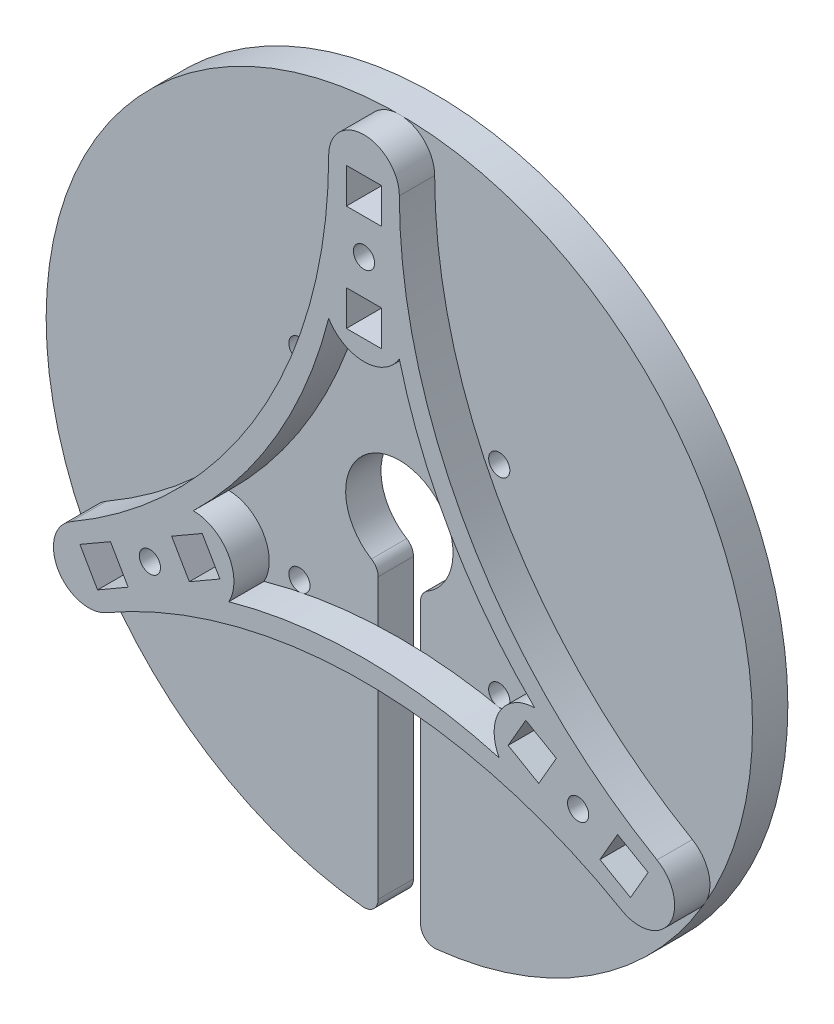
from build123d import *

# Parameters (mm, degrees)
BODY_MOVE_COPY2_START     = 18.4153099
BODY_MOVE_COPY2_OUTLINE_R = 1.5
BODY_MOVE_COPY2_OUTLINE_W = 5
BODY_MOVE_COPY2_OUTLINE_H = 5
BODY_MOVE_COPY2_DEPTH     = 5
SKETCH2_R                 = 1.5
SKETCH2_W                 = 5
SKETCH2_H                 = 5
BOSS_EXTRUDE1_DEPTH       = 5


# Read off the part's stored shape, not the designer's step: Body-Move/Copy2
with BuildPart() as part:
    # Body-Move/Copy2 outline → Body-Move/Copy2 (new body)
    with BuildSketch(Plane.XY.offset(BODY_MOVE_COPY2_START)):
        with BuildLine():
            ThreePointArc((-29.993059319, -14.335142591), (-30.249021858, -13.35619758), (-30.951392653, -12.62782582))
            ThreePointArc((-30.951392653, -12.62782582), (-26.993059319, 1.459977909), (-23.034725986, -12.62782582))
            ThreePointArc((-23.034725986, -12.62782582), (-23.737096781, -13.35619758), (-23.993059319, -14.335142591))
            Line((-23.993059319, -14.335142591), (-23.993059319, -53.87889514))
            ThreePointArc((-23.993059319, -53.87889514), (-23.331590853, -55.364941349), (-21.784725986, -55.868014851))
            ThreePointArc((-21.784725986, -55.868014851), (-26.993059319, 43.859977909), (-32.201392653, -55.868014851))
            ThreePointArc((-32.201392653, -55.868014851), (-30.654527786, -55.364941349), (-29.993059319, -53.87889514))
            Line((-29.993059319, -53.87889514), (-29.993059319, -14.335142591))
        make_face()
        Polygon((-67.21420249, -26.474958582), (-62.884075471, -23.974958582), (-60.384075471, -28.305085601), (-64.71420249, -30.805085601), align=None, mode=Mode.SUBTRACT)
        with Locations((-57.303948452, -23.640022091)):
            Circle(BODY_MOVE_COPY2_OUTLINE_R, mode=Mode.SUBTRACT)
        Polygon((-47.393694414, -20.805085601), (-51.723821433, -23.305085601), (-54.223821433, -18.974958582), (-49.893694414, -16.474958582), align=None, mode=Mode.SUBTRACT)
        with Locations((-41.135194943, -20.282157715)):
            Circle(BODY_MOVE_COPY2_OUTLINE_R, mode=Mode.SUBTRACT)
        with Locations((-12.850923696, -20.282157715)):
            Circle(BODY_MOVE_COPY2_OUTLINE_R, mode=Mode.SUBTRACT)
        Polygon((-4.092424225, -16.474958582), (0.237702794, -18.974958582), (-2.262297206, -23.305085601), (-6.592424225, -20.805085601), align=None, mode=Mode.SUBTRACT)
        Polygon((10.728083851, -30.805085601), (6.397956832, -28.305085601), (8.897956832, -23.974958582), (13.228083851, -26.474958582), align=None, mode=Mode.SUBTRACT)
        with Locations((3.317829813, -23.640022091)):
            Circle(BODY_MOVE_COPY2_OUTLINE_R, mode=Mode.SUBTRACT)
        with Locations((-41.135194943, 8.002113533)):
            Circle(BODY_MOVE_COPY2_OUTLINE_R, mode=Mode.SUBTRACT)
        with Locations((-12.850923696, 8.002113533)):
            Circle(BODY_MOVE_COPY2_OUTLINE_R, mode=Mode.SUBTRACT)
        with Locations((-26.993059319, 21.359977909)):
            Rectangle(BODY_MOVE_COPY2_OUTLINE_W, BODY_MOVE_COPY2_OUTLINE_H, mode=Mode.SUBTRACT)
        with Locations((-26.993059319, 28.859977909)):
            Circle(BODY_MOVE_COPY2_OUTLINE_R, mode=Mode.SUBTRACT)
        with Locations((-26.993059319, 36.359977909)):
            Rectangle(BODY_MOVE_COPY2_OUTLINE_W, BODY_MOVE_COPY2_OUTLINE_H, mode=Mode.SUBTRACT)
    extrude(amount=BODY_MOVE_COPY2_DEPTH)


with BuildPart() as body_2:
    # Sketch2 → Boss-Extrude1 (new body)
    with BuildSketch(Plane.XY.offset(23.4153099)):
        with BuildLine():
            ThreePointArc((-68.46420249, -24.309895072), (-70.294329509, -31.140022091), (-63.46420249, -32.97014911))
            ThreePointArc((-63.46420249, -32.97014911), (-26.993059319, -23.197735751), (9.478083851, -32.97014911))
            ThreePointArc((9.478083851, -32.97014911), (16.30821087, -31.140022091), (14.478083851, -24.309895072))
            ThreePointArc((14.478083851, -24.309895072), (-12.22064596, 2.388834739), (-21.993059319, 38.859977909))
            ThreePointArc((-21.993059319, 38.859977909), (-26.993059319, 43.859977909), (-31.993059319, 38.859977909))
            ThreePointArc((-31.993059319, 38.859977909), (-41.765472679, 2.388834739), (-68.46420249, -24.309895072))
        make_face()
        with Locations((-26.993059319, 28.859977909)):
            Circle(SKETCH2_R, mode=Mode.SUBTRACT)
        with Locations((3.317829813, -23.640022091)):
            Circle(SKETCH2_R, mode=Mode.SUBTRACT)
        with Locations((-57.303948452, -23.640022091)):
            Circle(SKETCH2_R, mode=Mode.SUBTRACT)
        with BuildLine():
            ThreePointArc((-46.143694414, -22.97014911), (-26.993059319, -20.320580734), (-7.842424225, -22.97014911))
            ThreePointArc((-7.842424225, -22.97014911), (-7.794100483, -17.224546144), (-2.842424225, -14.309895072))
            ThreePointArc((-2.842424225, -14.309895072), (-14.712335295, 0.95025723), (-21.993059319, 18.859977909))
            ThreePointArc((-21.993059319, 18.859977909), (-26.993059319, 16.029026014), (-31.993059319, 18.859977909))
            ThreePointArc((-31.993059319, 18.859977909), (-39.273783344, 0.95025723), (-51.143694414, -14.309895072))
            ThreePointArc((-51.143694414, -14.309895072), (-46.192018156, -17.224546144), (-46.143694414, -22.97014911))
        make_face(mode=Mode.SUBTRACT)
        with Locations((-26.993059319, 36.359977909)):
            Rectangle(SKETCH2_W, SKETCH2_H, mode=Mode.SUBTRACT)
        with Locations((-26.993059319, 21.359977909)):
            Rectangle(SKETCH2_W, SKETCH2_H, mode=Mode.SUBTRACT)
        Polygon((0.237702794, -18.974958582), (-4.092424225, -16.474958582), (-6.592424225, -20.805085601), (-2.262297206, -23.305085601), align=None, mode=Mode.SUBTRACT)
        Polygon((8.897956832, -23.974958582), (13.228083851, -26.474958582), (10.728083851, -30.805085601), (6.397956832, -28.305085601), align=None, mode=Mode.SUBTRACT)
        Polygon((-62.884075471, -23.974958582), (-67.21420249, -26.474958582), (-64.71420249, -30.805085601), (-60.384075471, -28.305085601), align=None, mode=Mode.SUBTRACT)
        Polygon((-54.223821433, -18.974958582), (-49.893694414, -16.474958582), (-47.393694414, -20.805085601), (-51.723821433, -23.305085601), align=None, mode=Mode.SUBTRACT)
    extrude(amount=BOSS_EXTRUDE1_DEPTH)


solid = Compound([part.part, body_2.part])
